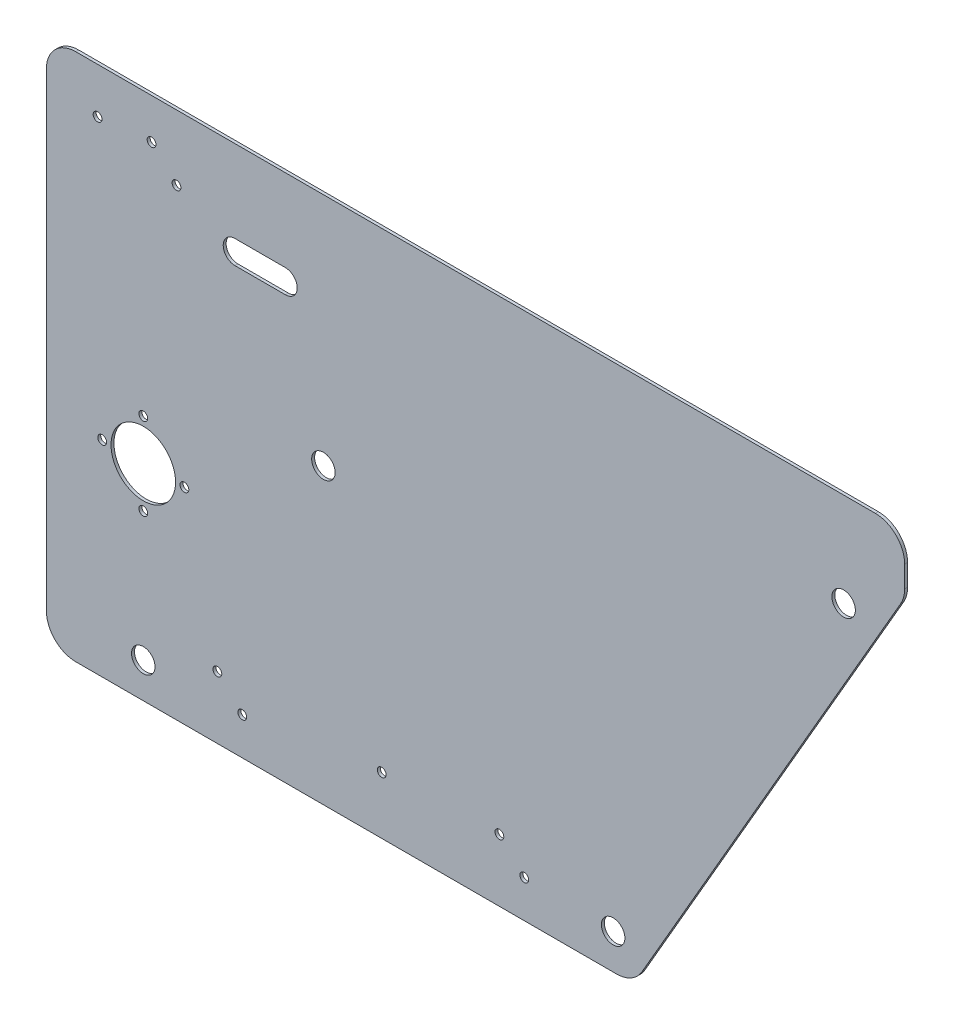
from build123d import *

# Parameters (mm, degrees)
BOSS_EXTRUDE1_DEPTH = 1
FILLET1_R           = 10
SKETCH2_R           = 4
SKETCH2_R_2         = 11
SKETCH2_R_3         = 1.5
CUT_EXTRUDE1_DEPTH  = 3


with BuildPart() as part:
    # Sketch1 → Boss-Extrude1 (new body)
    with BuildSketch(Plane.XY):
        Polygon((-100, 100), (-100, -80), (100, -80), (192.37604307, 80), (192.37604307, 100), align=None)
    extrude(amount=BOSS_EXTRUDE1_DEPTH)

    # Fillet1
    fillet1_edges = [part.edges().sort_by_distance(p)[0] for p in [
        (100, -80, 0.5),
        (-100, -80, 0.5),
        (192.37604307, 100, 0.5),
        (-100, 100, 0.5),
        (192.37604307, 80, 0.5),
    ]]
    fillet(fillet1_edges, radius=FILLET1_R)

    # Sketch2 → Cut-Extrude1 (cut)
    with BuildSketch(Plane.XY.offset(1)):
        with Locations((93.07179677, -68)):
            Circle(SKETCH2_R)
        with Locations((171.59143338, 68)):
            Circle(SKETCH2_R)
        with Locations((-67, -10)):
            Circle(SKETCH2_R_2)
        with Locations((-67, -68)):
            Circle(SKETCH2_R)
        with Locations((-53, -10)):
            Circle(SKETCH2_R_3)
        with Locations((-67, 4)):
            Circle(SKETCH2_R_3)
        with Locations((-81, -10)):
            Circle(SKETCH2_R_3)
        with Locations((-67, -24)):
            Circle(SKETCH2_R_3)
        with Locations((-5.638951331, 20)):
            Circle(SKETCH2_R)
        with Locations((62.79605759, -67.242640687)):
            Circle(SKETCH2_R_3)
        with Locations((54.310776216, -58.757359313)):
            Circle(SKETCH2_R_3)
        with Locations((-33.274226936, -67.242640687)):
            Circle(SKETCH2_R_3)
        with Locations((-41.75950831, -58.757359313)):
            Circle(SKETCH2_R_3)
        with Locations((14.225855729, -60.5)):
            Circle(SKETCH2_R_3)
        with Locations((-55.688186982, 77.757359313)):
            Circle(SKETCH2_R_3)
        with Locations((-64.173468356, 86.242640687)):
            Circle(SKETCH2_R_3)
        with Locations((-82.576317869, 84.5)):
            Circle(SKETCH2_R_3)
        with BuildLine():
            Line((-35.769581398, 72), (-18.553327999, 72))
            ThreePointArc((-18.553327999, 72), (-14.553327999, 68), (-18.553327999, 64))
            Line((-18.553327999, 64), (-35.769581398, 64))
            ThreePointArc((-35.769581398, 64), (-39.769581398, 68), (-35.769581398, 72))
        make_face()
    extrude(amount=-CUT_EXTRUDE1_DEPTH, mode=Mode.SUBTRACT)


solid = part.part
